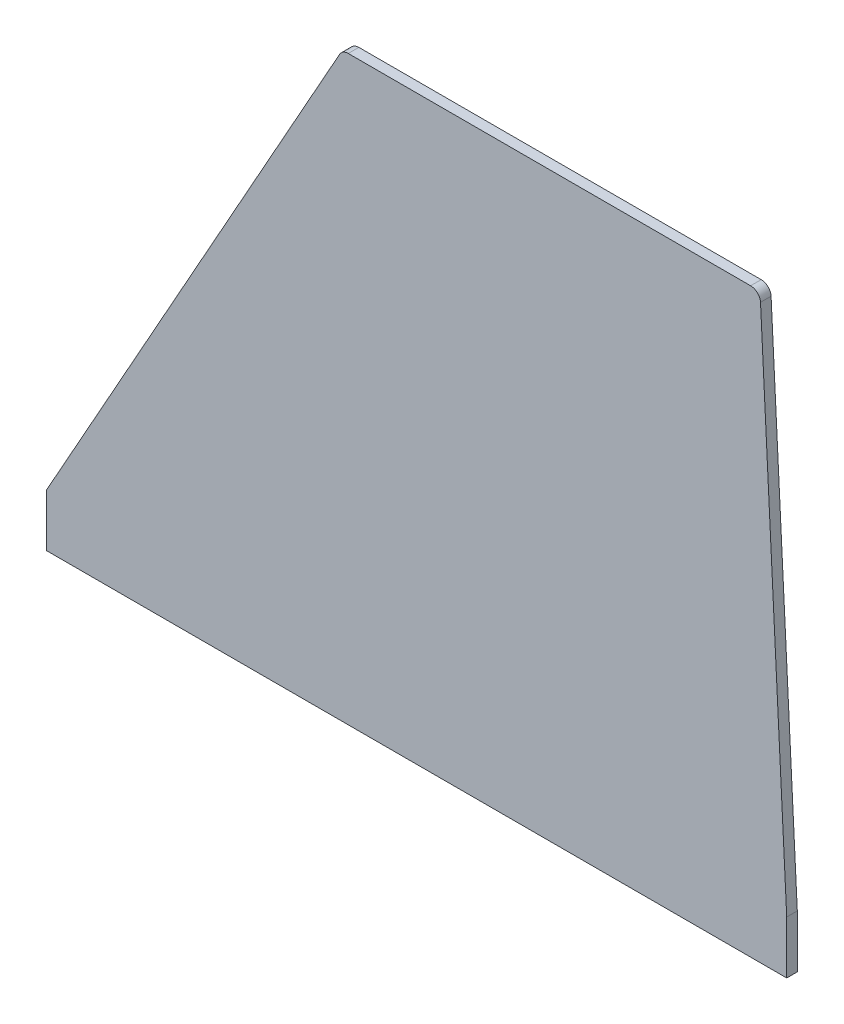
from build123d import *

# Parameters (mm, degrees)
BOSS_EXTRUDE3_DEPTH = 2.54
FILLET2_R           = 4.7625


with BuildPart() as part:
    # Sketch1 → Boss-Extrude3 (new, symmetric)
    with BuildSketch(Plane.XY):
        Polygon((0, 0), (142.113, 254), (342.773, 254), (355.6, 0), (355.6, -25.4), (0, -25.4), align=None)
    extrude(amount=BOSS_EXTRUDE3_DEPTH, both=True)

    # Fillet2
    fillet2_edges = [part.edges().sort_by_distance(p)[0] for p in [
        (342.773, 254, 0),
        (142.113, 254, 0),
    ]]
    fillet(fillet2_edges, radius=FILLET2_R)


solid = part.part
